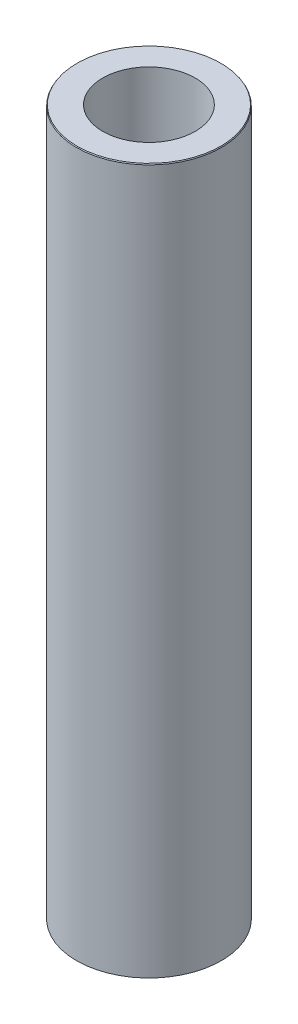
from build123d import *
from OCP.BRepFilletAPI import BRepFilletAPI_MakeChamfer

# Parameters (mm, degrees)
SKETCH1_R           = 57.5
BOSS_EXTRUDE1_DEPTH = 560.320718082
SKETCH2_R           = 36.747003109
CUT_EXTRUDE1_DEPTH  = 567.190610229
CHAMFER1_SIZE       = 0.757446686
CHAMFER1_SIZE2      = 0.437312048


with BuildPart() as part:
    # Sketch1 → Boss-Extrude1 (new body)
    with BuildSketch(Plane(origin=(0, 0, 0), x_dir=(1, 0, 0), z_dir=(0, 1, 0))):
        Circle(SKETCH1_R)
    extrude(amount=BOSS_EXTRUDE1_DEPTH)

    # Sketch2 → Cut-Extrude1 (cut, through all)
    with BuildSketch(Plane(origin=(0, 0, 0), x_dir=(1, 0, 0), z_dir=(0, 1, 0))):
        Circle(SKETCH2_R)
    extrude(amount=CUT_EXTRUDE1_DEPTH, mode=Mode.SUBTRACT)

    # Chamfer1: one chamfer whose edges measure the first distance from different faces: ONE call of the kernel's chamfer builder (chamfer() names one face for all edges)
    chamfer1_edges_1 = [part.edges().sort_by_distance(p)[0] for p in [
        (-57.5, 560.320718082, 0),
    ]]
    chamfer1_side_1 = [part.faces().sort_by_distance(p)[0] for p in [
        (-57.5, 280.160359041, 0),
    ]]
    chamfer1_edges_2 = [part.edges().sort_by_distance(p)[0] for p in [
        (-57.5, 0, 0),
    ]]
    chamfer1_side_2 = [part.faces().sort_by_distance(p)[0] for p in [
        (-55.873654403, 0, 0),
    ]]
    chamfer1 = BRepFilletAPI_MakeChamfer(part.part.solid().wrapped)
    for e in chamfer1_edges_1:
        chamfer1.Add(CHAMFER1_SIZE, CHAMFER1_SIZE2, e.wrapped, chamfer1_side_1[0].wrapped)  # the first distance lies on this face
    for e in chamfer1_edges_2:
        chamfer1.Add(CHAMFER1_SIZE, CHAMFER1_SIZE2, e.wrapped, chamfer1_side_2[0].wrapped)  # the first distance lies on this face
    add(Compound.cast(chamfer1.Shape()), mode=Mode.REPLACE)


solid = part.part
